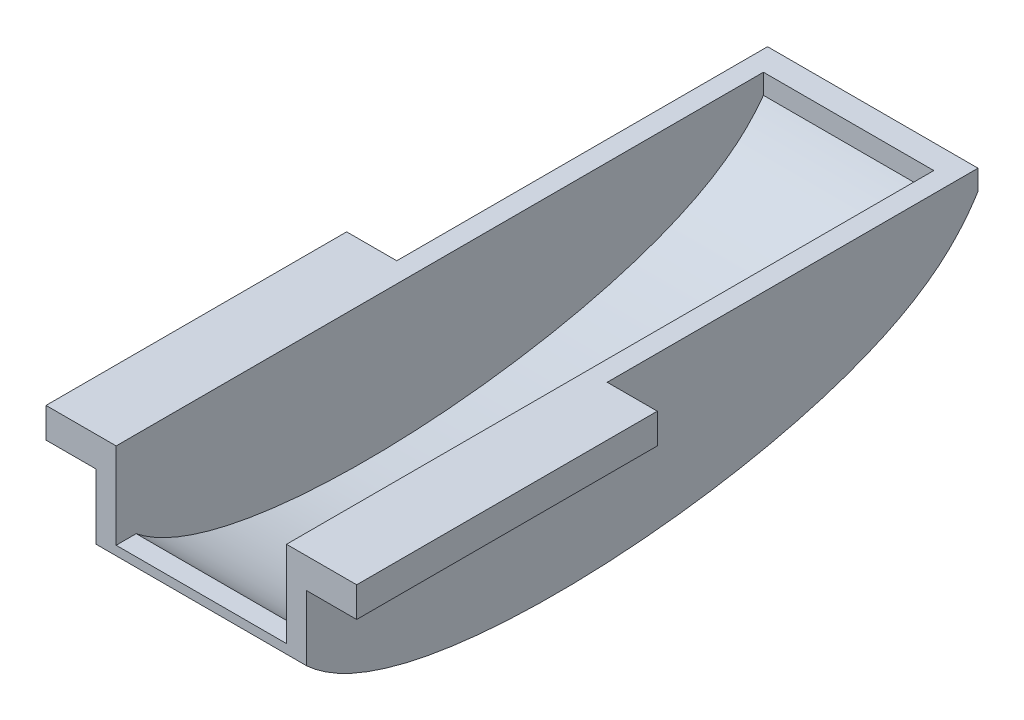
from build123d import *

# Parameters (mm, degrees)
BASEPIEDEAPPOGGIO_START = -10.5
BASEPIEDEAPPOGGIO_DEPTH = 21
LATOSINISTRO_DEPTH      = 2
SCHIZZO3_W              = 5
SCHIZZO3_H              = 3
ALETTEAGGANCIO_DEPTH    = 30


# Read off the part's stored shape, not the designer's step: BasePiedeAppoggio
with BuildPart() as part:
    # BasePiedeAppoggio outline → BasePiedeAppoggio (new body)
    with BuildSketch(Plane(origin=(0, 0, 0), x_dir=(0, 0, -1), z_dir=(1, 0, 0)).offset(BASEPIEDEAPPOGGIO_START)):
        with BuildLine():
            Line((-67, -6.58541733), (-67, -7.5))
            add(Edge.make_bspline(
                [(-67, -7.5), (-60, -14), (-44, -17), (-14, -13), (-5, -8), (0, 0)],
                knots=[0, 0, 0, 0, 0, 0, 1, 1, 1, 1, 1, 1], degree=5))
            Line((0, 0), (0, 2))
            Line((0, 2), (-2.409917527, 2))
            Line((-2.409917527, 2), (-2.409917527, 0))
            add(Edge.make_bspline(
                [(-2.409917527, 0), (-2.667324323, -0.353402954), (-3.476108464, -1.377540434), (-5.718312008, -3.574118885), (-10.497685703, -6.435761001), (-19.037438877, -9.233820798), (-29.572047533, -11.136431528), (-38.966676556, -11.799385995), (-46.135832891, -11.693755764), (-51.166703498, -11.28631183), (-55.693282116, -10.549034431), (-58.932001396, -9.671882802), (-61.157085706, -8.829738395), (-62.633910182, -8.137838289), (-63.931461685, -7.382278902), (-64.645771008, -6.869387628), (-65, -6.58541733)],
                knots=[0.030225408, 0.030225408, 0.030225408, 0.030225408, 0.061229523, 0.122459046, 0.244918093, 0.367377139, 0.489836186, 0.612295232, 0.673524756, 0.734754279, 0.795983802, 0.857213325, 0.887828087, 0.918442849, 0.94905761, 0.979672372, 0.979672372, 0.979672372, 0.979672372], degree=3))
            Line((-65, -6.58541733), (-67, -6.58541733))
        make_face()
    extrude(amount=BASEPIEDEAPPOGGIO_DEPTH)

    # Schizzo2 → LatoSinistro (add)
    with BuildSketch(Plane.ZY.offset(10.5)):
        with BuildLine():
            Line((67, -7.5), (67, 2))
            Line((67, 2), (0, 2))
            Line((0, 2), (0, 0))
            add(Edge.make_bspline(
                [(67, -7.5), (60, -14), (44, -17), (14, -13), (5, -8), (0, 0)],
                knots=[0, 0, 0, 0, 0, 0, 1, 1, 1, 1, 1, 1], degree=5))
        make_face()
    latosinistro = extrude(amount=-LATOSINISTRO_DEPTH)

    # LatoDestro: LatoSinistro across plane
    add(latosinistro.mirror(Plane(origin=(0, 0, 0), x_dir=(0, 0, 1), z_dir=(1, 0, 0))))

    # Schizzo3 → AletteAggancio (add)
    with BuildSketch(Plane.XY.offset(67)):
        with Locations((-13, 0.5)):
            Rectangle(SCHIZZO3_W, SCHIZZO3_H)
        with Locations((13, 0.5)):
            Rectangle(SCHIZZO3_W, SCHIZZO3_H)
    extrude(amount=-ALETTEAGGANCIO_DEPTH)


solid = part.part
